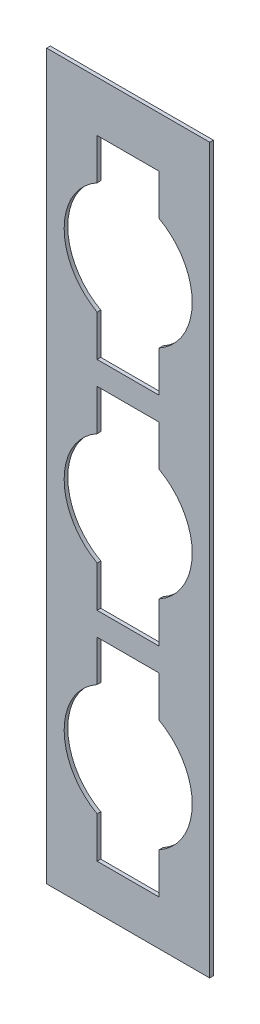
from build123d import *

# Parameters (mm, degrees)
SKETCH1_W           = 533.4
SKETCH1_H           = 2387.6
BOSS_EXTRUDE1_DEPTH = 11.90625
SKETCH3_W           = 533.4
SKETCH3_H           = 18.25625
CUT_EXTRUDE1_DEPTH  = 1653.779078667


with BuildPart() as part:
    # Sketch1 → Boss-Extrude1 (new body)
    with BuildSketch(Plane.XY):
        with Locations((120.527884615, 412.933173077)):
            Rectangle(SKETCH1_W, SKETCH1_H)
        with BuildLine():
            Line((18.927884615, 730.433173077), (222.127884615, 730.433173077))
            Line((222.127884615, 730.433173077), (222.127884615, 596.205218136))
            ThreePointArc((222.127884615, 596.205218136), (330.077884615, 412.933173077), (222.127884615, 229.661128018))
            Line((222.127884615, 229.661128018), (222.127884615, 95.433173077))
            Line((222.127884615, 95.433173077), (18.927884615, 95.433173077))
            Line((18.927884615, 95.433173077), (18.927884615, 229.661128018))
            ThreePointArc((18.927884615, 229.661128018), (-89.022115385, 412.933173077), (18.927884615, 596.205218136))
            Line((18.927884615, 596.205218136), (18.927884615, 730.433173077))
        make_face(mode=Mode.SUBTRACT)
        with BuildLine():
            Line((18.927884615, 19.233173077), (222.127884615, 19.233173077))
            Line((222.127884615, 19.233173077), (222.127884615, -114.994781864))
            ThreePointArc((222.127884615, -114.994781864), (330.077884615, -298.266826923), (222.127884615, -481.538871982))
            Line((222.127884615, -481.538871982), (222.127884615, -615.766826923))
            Line((222.127884615, -615.766826923), (18.927884615, -615.766826923))
            Line((18.927884615, -615.766826923), (18.927884615, -481.538871982))
            ThreePointArc((18.927884615, -481.538871982), (-89.022115385, -298.266826923), (18.927884615, -114.994781864))
            Line((18.927884615, -114.994781864), (18.927884615, 19.233173077))
        make_face(mode=Mode.SUBTRACT)
        with BuildLine():
            Line((18.927884615, 806.633173077), (222.127884615, 806.633173077))
            Line((222.127884615, 806.633173077), (222.127884615, 940.861128018))
            ThreePointArc((222.127884615, 940.861128018), (330.077884615, 1124.133173077), (222.127884615, 1307.405218136))
            Line((222.127884615, 1307.405218136), (222.127884615, 1441.633173077))
            Line((222.127884615, 1441.633173077), (18.927884615, 1441.633173077))
            Line((18.927884615, 1441.633173077), (18.927884615, 1307.405218136))
            ThreePointArc((18.927884615, 1307.405218136), (-89.022115385, 1124.133173077), (18.927884615, 940.861128018))
            Line((18.927884615, 940.861128018), (18.927884615, 806.633173077))
        make_face(mode=Mode.SUBTRACT)
    extrude(amount=BOSS_EXTRUDE1_DEPTH)

    # Sketch3 → Cut-Extrude1 (cut, through all)
    with BuildSketch(Plane.XY.offset(11.90625)):
        with Locations((120.527884615, -771.738701923)):
            Rectangle(SKETCH3_W, SKETCH3_H)
    extrude(amount=-CUT_EXTRUDE1_DEPTH, mode=Mode.SUBTRACT)


solid = part.part
